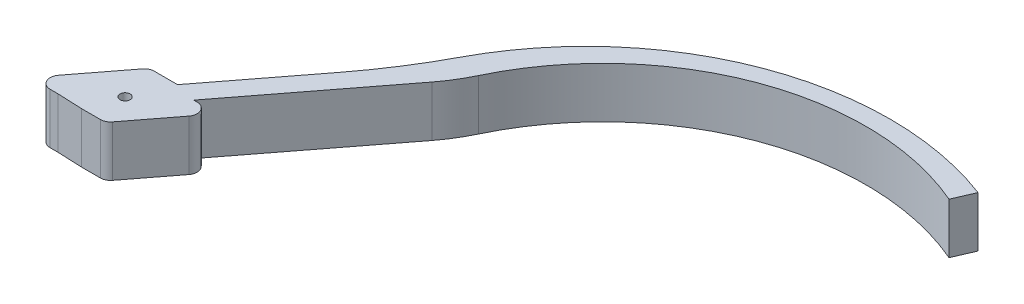
from build123d import *

# Parameters (mm, degrees)
SKETCH1_R           = 0.635
BOSS_EXTRUDE2_DEPTH = 6.35
FILLET3_R           = 20.32
FILLET4_R           = 66.04
FILLET5_R           = 1.27


with BuildPart() as part:
    # Sketch1 → Boss-Extrude2 (new body)
    with BuildSketch(Plane(origin=(0, 0, 0), x_dir=(1, 0, 0), z_dir=(0, 1, 0))):
        with BuildLine():
            Line((47.794805193, 18.995421593), (48.893920759, 21.535421593))
            ThreePointArc((48.893920759, 21.535421593), (20.039783642, 20.773744309), (0, 0))
            Line((0, 0), (-12.980190399, -16.911420131))
            Line((-12.980190399, -16.911420131), (-16.518171018, -16.911420131))
            Line((-16.518171018, -16.911420131), (-23.033495105, -25.4))
            Line((-23.033495105, -25.4), (-19.495514485, -25.4))
            Line((-19.495514485, -25.4), (-16.395019187, -25.532154609))
            Line((-16.395019187, -25.532154609), (-13.400017254, -25.532154609))
            Line((-13.400017254, -25.532154609), (-7.294557177, -17.577571719))
            Line((-7.294557177, -17.577571719), (-10.28955911, -17.577571719))
            Line((-10.28955911, -17.577571719), (4.121980582, 1.198701585))
            ThreePointArc((4.121980582, 1.198701585), (22.220591803, 19.269556921), (47.794805193, 18.995421593))
        make_face()
        with Locations((-14.945124193, -21.523440128)):
            Circle(SKETCH1_R, mode=Mode.SUBTRACT)
    extrude(amount=BOSS_EXTRUDE2_DEPTH)

    # Fillet3
    fillet3_edges = [part.edges().sort_by_distance(p)[0] for p in [
        (4.121980582, 3.175, -1.198701585),
    ]]
    fillet(fillet3_edges, radius=FILLET3_R)

    # Fillet4
    fillet4_edges = [part.edges().sort_by_distance(p)[0] for p in [
        (0, 3.175, 0),
    ]]
    fillet(fillet4_edges, radius=FILLET4_R)

    # Fillet5
    fillet5_edges = [part.edges().sort_by_distance(p)[0] for p in [
        (-16.518171018, 3.175, 16.911420131),
        (-23.033495105, 3.175, 25.4),
        (-7.294557177, 3.175, 17.577571719),
        (-13.400017254, 3.175, 25.532154609),
    ]]
    fillet(fillet5_edges, radius=FILLET5_R)


solid = part.part
